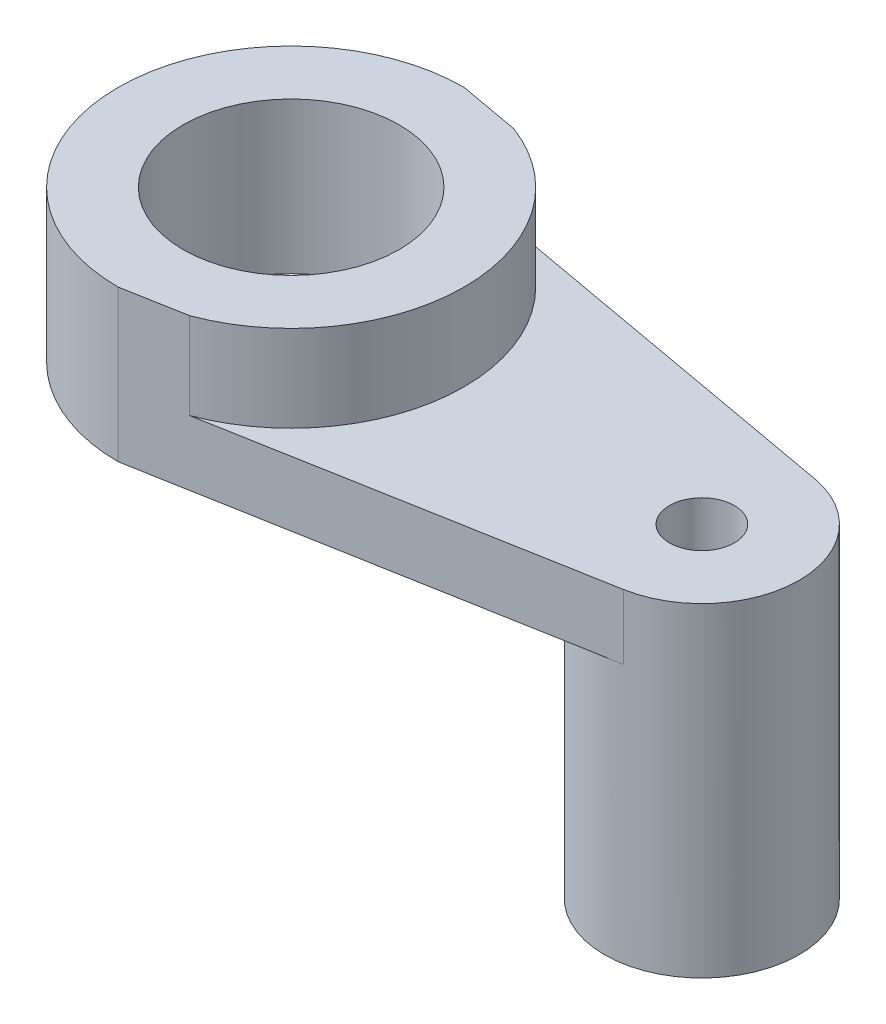
from build123d import *

# Parameters (mm, degrees)
SKETCH1_R           = 10
BOSS_EXTRUDE1_DEPTH = 14
SKETCH1_3_R         = 3
BOSS_EXTRUDE2_DEPTH = 6
BOSS_EXTRUDE3_START = -24
BOSS_EXTRUDE3_DEPTH = 24


with BuildPart() as part:
    # Sketch1 → Boss-Extrude1 (new body)
    with BuildSketch(Plane(origin=(0, 0, 0), x_dir=(1, 0, 0), z_dir=(0, 1, 0))):
        with BuildLine():
            ThreePointArc((5.590501251, -14.991540807), (13.142450685, -9.125567927), (16, 0))
            ThreePointArc((16, 0), (13.142450685, 9.125567927), (5.590501251, 14.991540807))
            Line((5.590501251, 14.991540807), (0, 16))
            ThreePointArc((0, 16), (-16, 0), (0, -16))
            Line((0, -16), (5.590501251, -14.991540807))
        make_face()
        Circle(SKETCH1_R, mode=Mode.SUBTRACT)
    extrude(amount=BOSS_EXTRUDE1_DEPTH)

    # Sketch1<3> → Boss-Extrude2 (add)
    with BuildSketch(Plane(origin=(0, 0, 0), x_dir=(1, 0, 0), z_dir=(0, 1, 0))):
        with BuildLine():
            ThreePointArc((5.590501251, 14.991540807), (16, 0), (5.590501251, -14.991540807))
            Line((5.590501251, -14.991540807), (39.597705334, -8.857050167))
            ThreePointArc((39.597705334, -8.857050167), (47, 0), (39.597705334, 8.857050167))
            Line((39.597705334, 8.857050167), (5.590501251, 14.991540807))
        make_face()
        with Locations((38, 0)):
            Circle(SKETCH1_3_R, mode=Mode.SUBTRACT)
    extrude(amount=BOSS_EXTRUDE2_DEPTH)

    # Sketch1<4> → Boss-Extrude3 (add)
    with BuildSketch(Plane(origin=(0, 0, 0), x_dir=(1, 0, 0), z_dir=(0, 1, 0)).offset(BOSS_EXTRUDE3_START)):
        with BuildLine():
            ThreePointArc((39.597705334, 8.857050167), (32.228490146, 6.905771065), (29, 0))
            ThreePointArc((29, 0), (32.228490146, -6.905771065), (39.597705334, -8.857050167))
            ThreePointArc((39.597705334, -8.857050167), (44.905771065, -5.771509854), (47, 0))
            ThreePointArc((47, 0), (44.905771065, 5.771509854), (39.597705334, 8.857050167))
        make_face()
        with BuildLine():
            ThreePointArc((41, 0), (38, -3), (35, 0))
            ThreePointArc((35, 0), (38, 3), (41, 0))
        make_face(mode=Mode.SUBTRACT)
    extrude(amount=BOSS_EXTRUDE3_DEPTH)


solid = part.part
